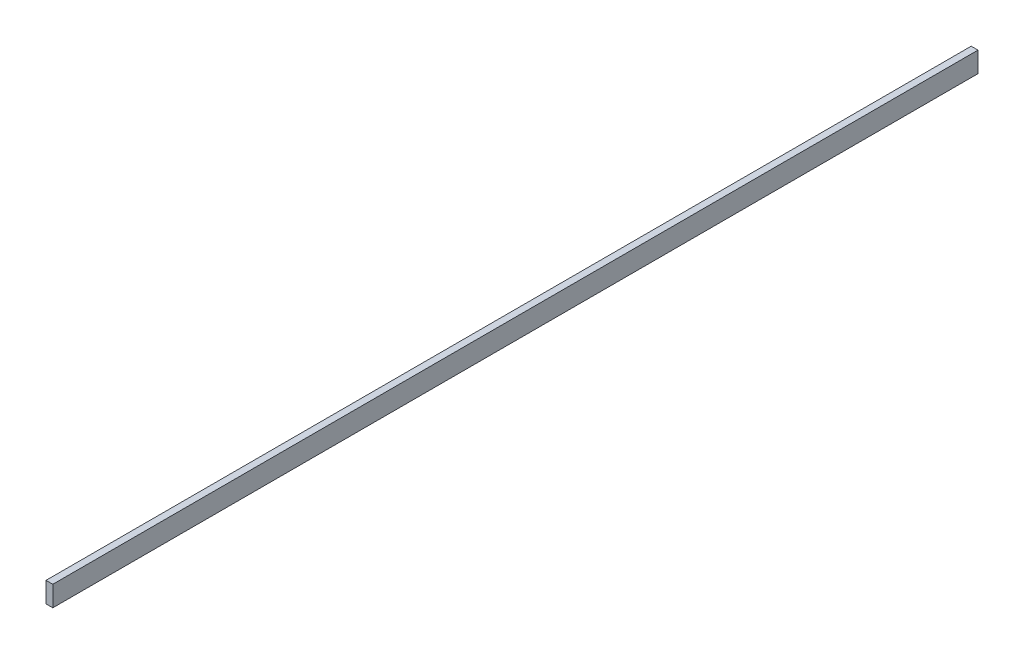
from build123d import *

# Parameters (mm, degrees)
SKIZZE1_W                       = 5
SKIZZE1_H                       = 15
AUFSATZ_LINEAR_AUSTRAGEN1_DEPTH = 680


with BuildPart() as part:
    # Skizze1 → Aufsatz-Linear austragen1 (new body)
    with BuildSketch(Plane.XY):
        with Locations((2.5, 7.5)):
            Rectangle(SKIZZE1_W, SKIZZE1_H)
    extrude(amount=AUFSATZ_LINEAR_AUSTRAGEN1_DEPTH)


solid = part.part
